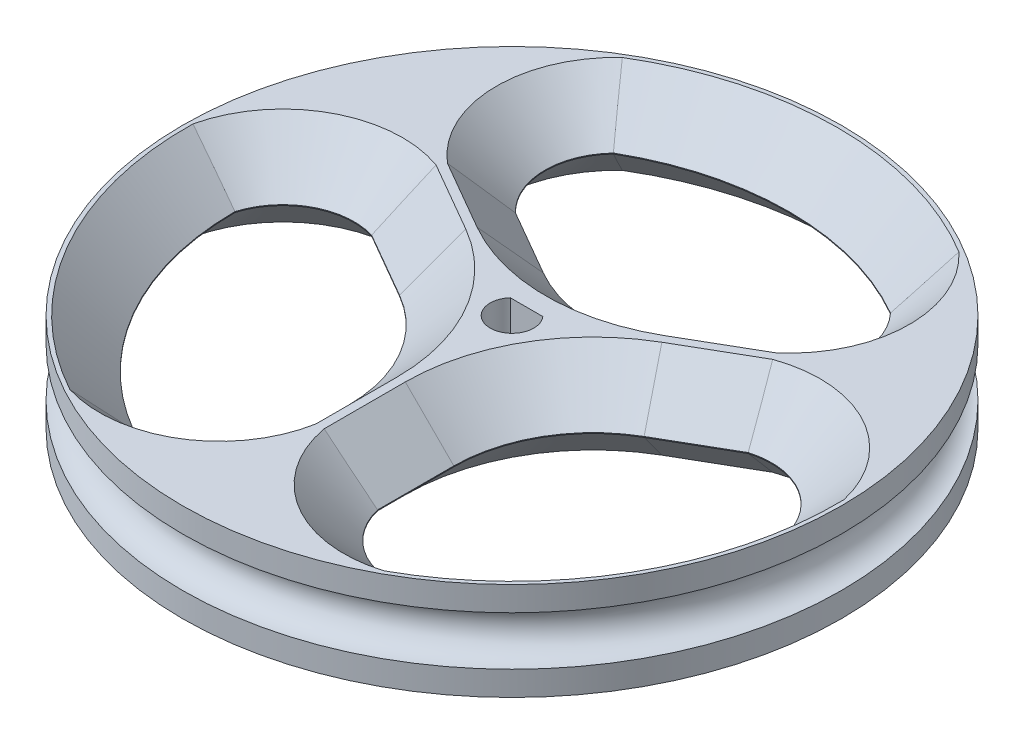
from build123d import *

# Parameters (mm, degrees)
SKETCH1_R           = 23.7871
BOSS_EXTRUDE1_DEPTH = 7.0612
SKETCH3_R           = 1.7653
SKETCH5_R           = 1.575
CUT_EXTRUDE1_DEPTH  = 7.0612
BOSS_EXTRUDE3_DEPTH = 7.0612
CUT_EXTRUDE2_DEPTH  = 10
CHAMFER1_SIZE       = 3.5
CHAMFER2_SIZE       = 3.5
CHAMFER3_SIZE       = 3.5
CHAMFER4_SIZE       = 3.5
CHAMFER5_SIZE       = 3.5
CHAMFER6_SIZE       = 3.5


with BuildPart() as part:
    # Sketch1 → Boss-Extrude1 (new body)
    with BuildSketch(Plane(origin=(0, 0, 0), x_dir=(1, 0, 0), z_dir=(0, 1, 0))):
        with Locations(Location((0, 0, 0), (0, 0, 270))):
            Circle(SKETCH1_R)
    extrude(amount=BOSS_EXTRUDE1_DEPTH)

    # Sketch3 → Cut-Revolve1 (revolve, cut)
    with BuildSketch(Plane(origin=(0, 0, 0), x_dir=(0, 0, -1), z_dir=(1, 0, 0))):
        with Locations((23.7871, 3.5306)):
            Circle(SKETCH3_R)
    revolve(axis=Axis((0, 3.5306, 0), (0, 1, 0)), mode=Mode.SUBTRACT)

    # Sketch5 → Cut-Extrude1 (cut)
    with BuildSketch(Plane.XZ):
        with Locations(Location((0, 0, 0), (0, 0, 270))):
            Circle(SKETCH5_R)
    extrude(amount=-CUT_EXTRUDE1_DEPTH, mode=Mode.SUBTRACT)

    # Sketch8 → Boss-Extrude3 (add)
    with BuildSketch(Plane.XZ):
        with BuildLine():
            ThreePointArc((-1.173935688, -1.05), (0, -1.575), (1.173935688, -1.05))
            Line((1.173935688, -1.05), (-1.173935688, -1.05))
        make_face()
    extrude(amount=-BOSS_EXTRUDE3_DEPTH)

    # Sketch18 → Cut-Extrude2 (cut)
    with BuildSketch(Plane(origin=(0, 7.0612, 0), x_dir=(1, 0, 0), z_dir=(0, 1, 0))):
        with BuildLine():
            Line((-8.82820323, 0.709103466), (-13.591342951, 3.459103466))
            ThreePointArc((-13.591342951, 3.459103466), (-17.51207526, 3.056828066), (-20, 0))
            ThreePointArc((-20, 0), (-17.320508076, -10), (-10, -17.320508076))
            ThreePointArc((-10, -17.320508076), (-6.10874687, -16.694316081), (-3.8, -13.5))
            Line((-3.8, -13.5), (-3.8, -8))
            ThreePointArc((-3.8, -8), (-5.147302995, -2.97179677), (-8.82820323, 0.709103466))
        make_face()
        with BuildLine():
            Line((3.8, -8), (3.8, -13.5))
            ThreePointArc((3.8, -13.5), (6.10874687, -16.694316081), (10, -17.320508076))
            ThreePointArc((10, -17.320508076), (17.320508076, -10), (20, 0))
            ThreePointArc((20, 0), (17.51207526, 3.056828066), (13.591342951, 3.459103466))
            Line((13.591342951, 3.459103466), (8.82820323, 0.709103466))
            ThreePointArc((8.82820323, 0.709103466), (5.147302995, -2.97179677), (3.8, -8))
        make_face()
        with BuildLine():
            Line((5.02820323, 7.290896534), (9.791342951, 10.040896534))
            ThreePointArc((9.791342951, 10.040896534), (11.40332839, 13.637488015), (10, 17.320508076))
            ThreePointArc((10, 17.320508076), (0, 20), (-10, 17.320508076))
            ThreePointArc((-10, 17.320508076), (-11.40332839, 13.637488015), (-9.791342951, 10.040896534))
            Line((-9.791342951, 10.040896534), (-5.02820323, 7.290896534))
            ThreePointArc((-5.02820323, 7.290896534), (0, 5.943593539), (5.02820323, 7.290896534))
        make_face()
    extrude(amount=-CUT_EXTRUDE2_DEPTH, mode=Mode.SUBTRACT)

    # Chamfer1
    chamfer1_edges = [part.edges().sort_by_distance(p)[0] for p in [
        (-17.51207526, 7.0612, -3.056828066),
    ]]
    chamfer(chamfer1_edges, length=CHAMFER1_SIZE)
    chamfer1_2_edges = [part.edges().sort_by_distance(p)[0] for p in [
        (-6.10874687, 7.0612, 16.694316081),
    ]]
    chamfer(chamfer1_2_edges, length=CHAMFER1_SIZE)
    chamfer1_3_edges = [part.edges().sort_by_distance(p)[0] for p in [
        (-11.209773091, 7.0612, -2.084103466),
        (-3.8, 7.0612, 10.75),
        (-5.147302995, 7.0612, 2.97179677),
    ]]
    chamfer(chamfer1_3_edges, length=CHAMFER1_SIZE)
    chamfer1_4_edges = [part.edges().sort_by_distance(p)[0] for p in [
        (-17.320508076, 7.0612, 10),
    ]]
    chamfer(chamfer1_4_edges, length=CHAMFER1_SIZE - 0.0001)  # a hair under: the kernel refuses the full size

    # Chamfer2
    chamfer2_edges = [part.edges().sort_by_distance(p)[0] for p in [
        (-11.40332839, 7.0612, -13.637488015),
    ]]
    chamfer(chamfer2_edges, length=CHAMFER2_SIZE)
    chamfer2_2_edges = [part.edges().sort_by_distance(p)[0] for p in [
        (11.40332839, 7.0612, -13.637488015),
    ]]
    chamfer(chamfer2_2_edges, length=CHAMFER2_SIZE)
    chamfer2_3_edges = [part.edges().sort_by_distance(p)[0] for p in [
        (7.409773091, 7.0612, -8.665896534),
        (0, 7.0612, -5.943593539),
        (-7.409773091, 7.0612, -8.665896534),
    ]]
    chamfer(chamfer2_3_edges, length=CHAMFER2_SIZE)
    chamfer2_4_edges = [part.edges().sort_by_distance(p)[0] for p in [
        (0, 7.0612, -20),
    ]]
    chamfer(chamfer2_4_edges, length=CHAMFER2_SIZE - 0.0001)  # a hair under: the kernel refuses the full size

    # Chamfer3
    chamfer3_edges = [part.edges().sort_by_distance(p)[0] for p in [
        (17.51207526, 7.0612, -3.056828066),
    ]]
    chamfer(chamfer3_edges, length=CHAMFER3_SIZE)
    chamfer3_2_edges = [part.edges().sort_by_distance(p)[0] for p in [
        (6.10874687, 7.0612, 16.694316081),
    ]]
    chamfer(chamfer3_2_edges, length=CHAMFER3_SIZE)
    chamfer3_3_edges = [part.edges().sort_by_distance(p)[0] for p in [
        (5.147302995, 7.0612, 2.97179677),
        (11.209773091, 7.0612, -2.084103466),
        (3.8, 7.0612, 10.75),
    ]]
    chamfer(chamfer3_3_edges, length=CHAMFER3_SIZE - 0.0001)  # a hair under: the kernel refuses the full size
    chamfer3_4_edges = [part.edges().sort_by_distance(p)[0] for p in [
        (17.320508076, 7.0612, 10),
    ]]
    chamfer(chamfer3_4_edges, length=CHAMFER3_SIZE - 0.0001)  # a hair under: the kernel refuses the full size

    # Chamfer4
    chamfer4_edges = [part.edges().sort_by_distance(p)[0] for p in [
        (17.51207526, 0, -3.056828066),
    ]]
    chamfer(chamfer4_edges, length=CHAMFER4_SIZE)
    chamfer4_2_edges = [part.edges().sort_by_distance(p)[0] for p in [
        (6.10874687, 0, 16.694316081),
    ]]
    chamfer(chamfer4_2_edges, length=CHAMFER4_SIZE)
    chamfer4_3_edges = [part.edges().sort_by_distance(p)[0] for p in [
        (17.320508076, 0, 10),
    ]]
    chamfer(chamfer4_3_edges, length=CHAMFER4_SIZE - 0.0001)  # a hair under: the kernel refuses the full size
    chamfer4_4_edges = [part.edges().sort_by_distance(p)[0] for p in [
        (11.209773091, 0, -2.084103466),
        (3.8, 0, 10.75),
        (5.147302995, 0, 2.97179677),
    ]]
    chamfer(chamfer4_4_edges, length=CHAMFER4_SIZE)

    # Chamfer5
    chamfer5_edges = [part.edges().sort_by_distance(p)[0] for p in [
        (-11.40332839, 0, -13.637488015),
    ]]
    chamfer(chamfer5_edges, length=CHAMFER5_SIZE)
    chamfer5_2_edges = [part.edges().sort_by_distance(p)[0] for p in [
        (11.40332839, 0, -13.637488015),
    ]]
    chamfer(chamfer5_2_edges, length=CHAMFER5_SIZE)
    chamfer5_3_edges = [part.edges().sort_by_distance(p)[0] for p in [
        (7.409773091, 0, -8.665896534),
        (0, 0, -5.943593539),
        (-7.409773091, 0, -8.665896534),
    ]]
    chamfer(chamfer5_3_edges, length=CHAMFER5_SIZE)
    chamfer5_4_edges = [part.edges().sort_by_distance(p)[0] for p in [
        (0, 0, -20),
    ]]
    chamfer(chamfer5_4_edges, length=CHAMFER5_SIZE - 0.0001)  # a hair under: the kernel refuses the full size

    # Chamfer6
    chamfer6_edges = [part.edges().sort_by_distance(p)[0] for p in [
        (-6.10874687, 0, 16.694316081),
    ]]
    chamfer(chamfer6_edges, length=CHAMFER6_SIZE)
    chamfer6_2_edges = [part.edges().sort_by_distance(p)[0] for p in [
        (-17.51207526, 0, -3.056828066),
    ]]
    chamfer(chamfer6_2_edges, length=CHAMFER6_SIZE)
    chamfer6_3_edges = [part.edges().sort_by_distance(p)[0] for p in [
        (-11.209773091, 0, -2.084103466),
        (-5.147302995, 0, 2.97179677),
        (-3.8, 0, 10.75),
    ]]
    chamfer(chamfer6_3_edges, length=CHAMFER6_SIZE)
    chamfer6_4_edges = [part.edges().sort_by_distance(p)[0] for p in [
        (-17.320508076, 0, 10),
    ]]
    chamfer(chamfer6_4_edges, length=CHAMFER6_SIZE - 0.0001)  # a hair under: the kernel refuses the full size


solid = part.part
